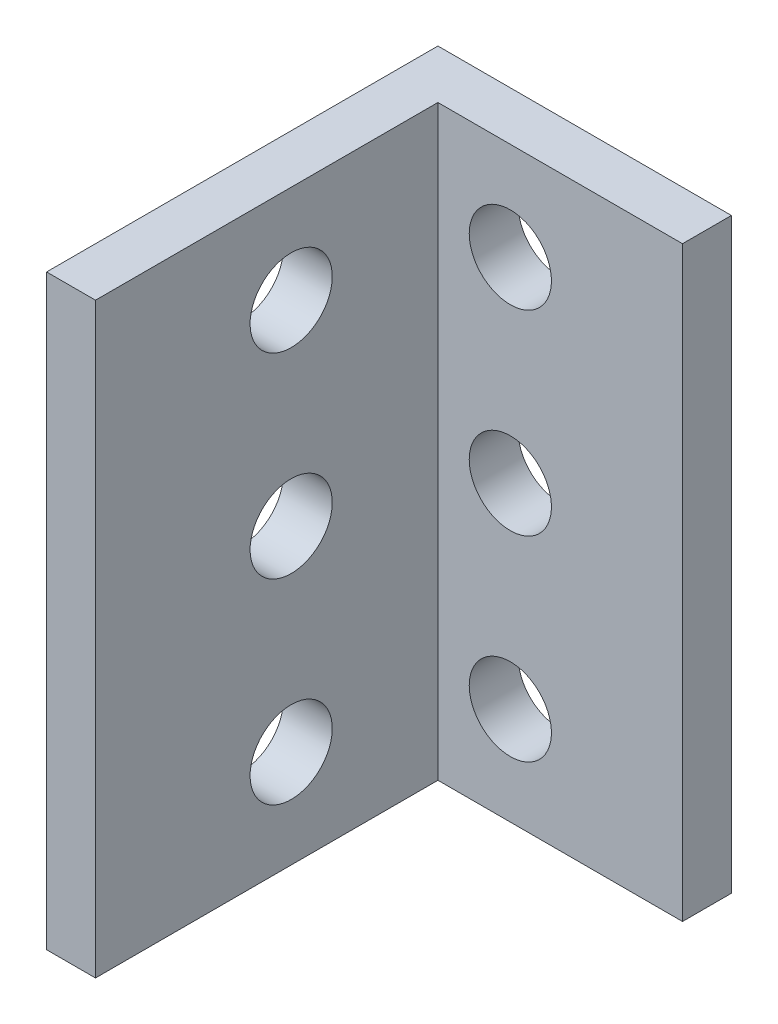
from build123d import *

# Parameters (mm, degrees)
SKETCH1_W           = 19.05
SKETCH1_H           = 38.1
SKETCH1_R           = 2.667
BOSS_EXTRUDE1_DEPTH = 3.175
SKETCH2_W           = 3.175
SKETCH2_H           = 38.1
BOSS_EXTRUDE2_DEPTH = 22.225
SKETCH4_R           = 2.667
CUT_EXTRUDE1_DEPTH  = 36.497579143


with BuildPart() as part:
    # Sketch1 → Boss-Extrude1 (new body)
    with BuildSketch(Plane.XY):
        with Locations((3.175, 0)):
            Rectangle(SKETCH1_W, SKETCH1_H)
        with Locations((1.524, -12.7)):
            Circle(SKETCH1_R, mode=Mode.SUBTRACT)
        with Locations((1.524, 0)):
            Circle(SKETCH1_R, mode=Mode.SUBTRACT)
        with Locations((1.524, 12.7)):
            Circle(SKETCH1_R, mode=Mode.SUBTRACT)
    extrude(amount=BOSS_EXTRUDE1_DEPTH)

    # Sketch2 → Boss-Extrude2 (add)
    with BuildSketch(Plane.XY.offset(3.175)):
        with Locations((-4.7625, 0)):
            Rectangle(SKETCH2_W, SKETCH2_H)
    extrude(amount=BOSS_EXTRUDE2_DEPTH)

    # Sketch4 → Cut-Extrude1 (cut, through all)
    with BuildSketch(Plane(origin=(-3.175, 0, 0), x_dir=(0, 0, -1), z_dir=(1, 0, 0))):
        with Locations((-12.7, -12.7)):
            Circle(SKETCH4_R)
        with Locations((-12.7, 0)):
            Circle(SKETCH4_R)
        with Locations((-12.7, 12.7)):
            Circle(SKETCH4_R)
    extrude(amount=-CUT_EXTRUDE1_DEPTH, mode=Mode.SUBTRACT)


solid = part.part
